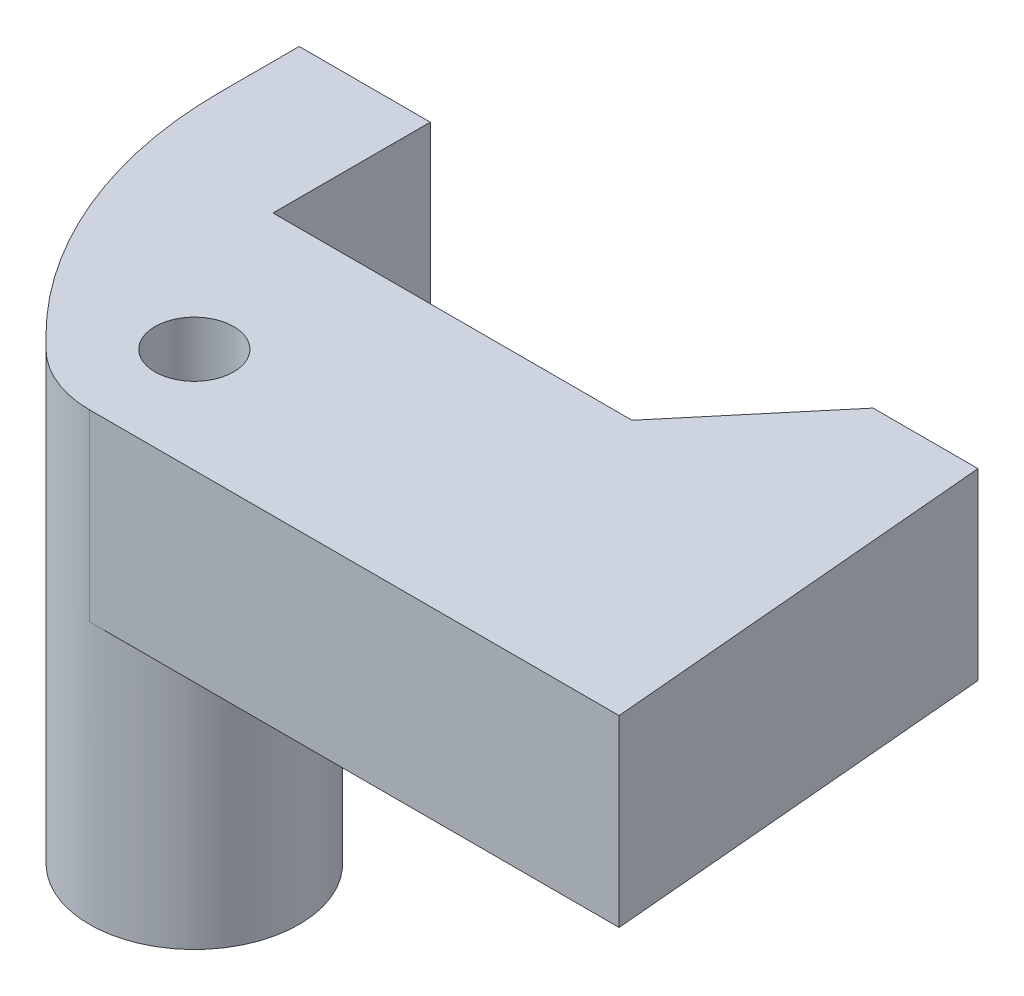
from build123d import *

# Parameters (mm, degrees)
SKETCH1_R           = 1.5
BOSS_EXTRUDE1_DEPTH = 7
BOSS_EXTRUDE2_START = 10
SKETCH2_R           = 1.5
BOSS_EXTRUDE2_DEPTH = 10


with BuildPart() as part:
    # Sketch1 → Boss-Extrude1 (new body)
    with BuildSketch(Plane(origin=(0, 0, 0), x_dir=(1, 0, 0), z_dir=(0, 1, 0))):
        with BuildLine():
            Line((-11, 13), (-11, 16))
            Line((-11, 16), (-6, 16))
            Line((-6, 16), (-6, 10))
            Line((-6, 10), (7.692171891, 10))
            Line((7.692171891, 10), (11.887670047, 15))
            Line((11.887670047, 15), (15.887670047, 15))
            Line((15.887670047, 15), (17.2, 0))
            Line((17.2, 0), (-3, 0))
            ThreePointArc((-3, 0), (-4.530733729, 0.30448187), (-5.828427125, 1.171572875))
            Line((-5.828427125, 1.171572875), (-6.292893219, 1.636038969))
            ThreePointArc((-6.292893219, 1.636038969), (-9.776662805, 6.849868608), (-11, 13))
        make_face()
        with Locations((-3, 4)):
            Circle(SKETCH1_R, mode=Mode.SUBTRACT)
    extrude(amount=BOSS_EXTRUDE1_DEPTH)

    # Sketch2 → Boss-Extrude2 (add)
    with BuildSketch(Plane.XZ.offset(BOSS_EXTRUDE2_START)):
        with BuildLine():
            Line((-5.828427125, -1.171572875), (-6.292893219, -1.636038969))
            ThreePointArc((-6.292893219, -1.636038969), (-9.776662805, -6.849868608), (-11, -13))
            Line((-11, -13), (-11, -16))
            Line((-11, -16), (-6, -16))
            Line((-6, -16), (-6, -8))
            Line((-6, -8), (-3, -8))
            ThreePointArc((-3, -8), (1, -4), (-3, 0))
            ThreePointArc((-3, 0), (-4.530733729, -0.30448187), (-5.828427125, -1.171572875))
        make_face()
        with Locations((-3, -4)):
            Circle(SKETCH2_R, mode=Mode.SUBTRACT)
    extrude(amount=-BOSS_EXTRUDE2_DEPTH)


solid = part.part
